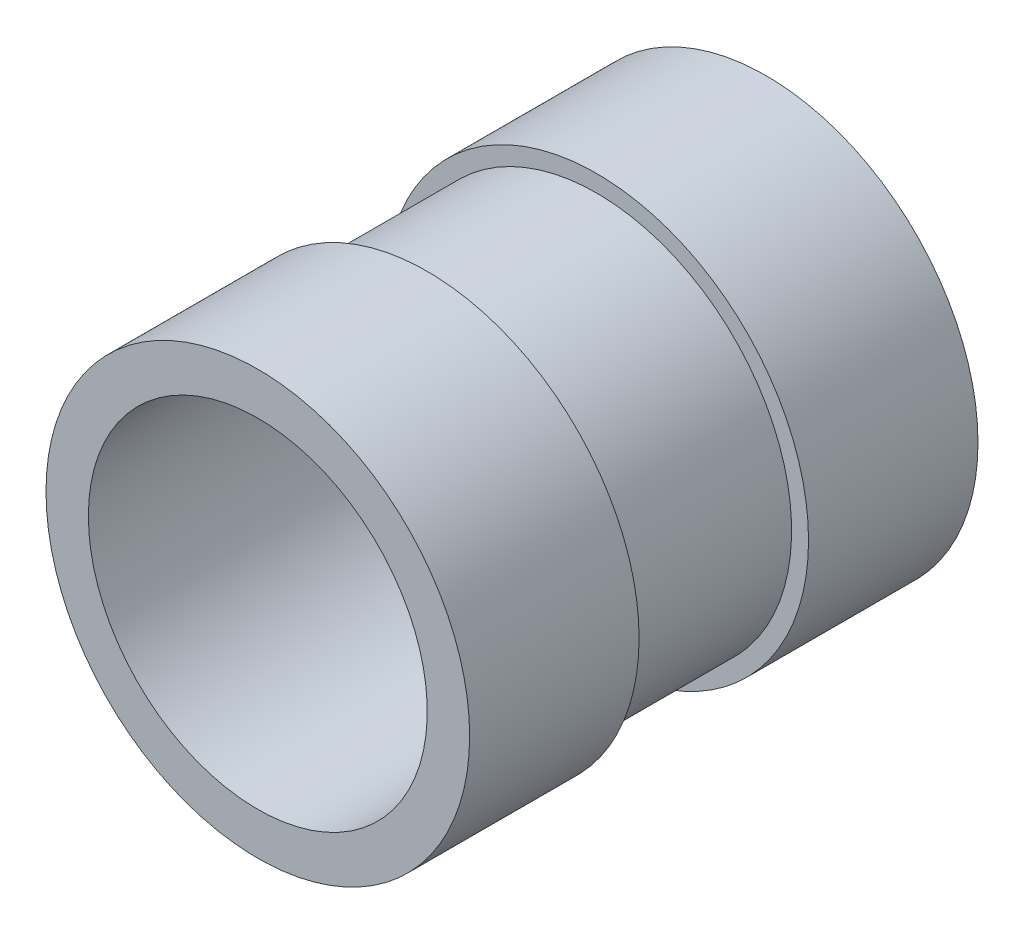
from build123d import *

# Parameters (mm, degrees)
SKETCH2_R          = 2
CUT_EXTRUDE1_DEPTH = 7.964194139


with BuildPart() as part:
    # Sketch1 → Revolve1 (revolve)
    with BuildSketch(Plane(origin=(0, 0, 0), x_dir=(1, 0, 0), z_dir=(0, 1, 0))):
        Polygon((0, 0), (2.5, 0), (2.5, 2), (2.3, 2), (2.3, 4), (2.5, 4), (2.5, 6), (0, 6), align=None)
    revolve(axis=Axis((0, 0, -11.944023292), (0, 0, 1)))

    # Sketch2 → Cut-Extrude1 (cut, through all)
    with BuildSketch(Plane(origin=(0, 0, -6), x_dir=(-1, 0, 0), z_dir=(0, 0, -1))):
        Circle(SKETCH2_R)
    extrude(amount=-CUT_EXTRUDE1_DEPTH, mode=Mode.SUBTRACT)


solid = part.part
